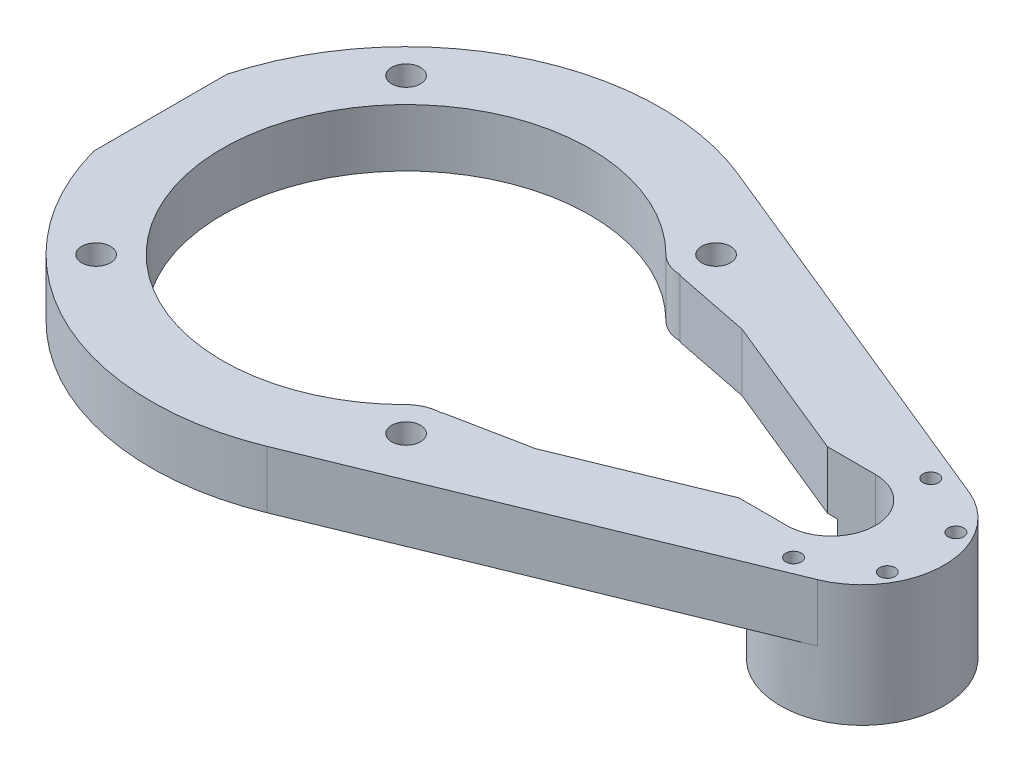
from build123d import *

# Parameters (mm, degrees)
SKETCH1_R           = 3.25
BOSS_EXTRUDE1_DEPTH = 13
BOSS_EXTRUDE2_START = -14.5
BOSS_EXTRUDE2_DEPTH = 14.5
CUT_EXTRUDE1_REACH  = 139.202
SKETCH3_R           = 1.75
SKETCH4_R           = 3.25
CUT_EXTRUDE2_DEPTH  = 5


with BuildPart() as part:
    # Sketch1 → Boss-Extrude1 (new body)
    with BuildSketch(Plane(origin=(0, 0, 0), x_dir=(1, 0, 0), z_dir=(0, 1, 0))):
        with BuildLine():
            ThreePointArc((21.76947877, 53.217002819), (-25.477840581, 51.544536415), (-55.5, 15.023634545))
            Line((-55.5, 15.023634545), (-55.5, -15.023634545))
            ThreePointArc((-55.5, -15.023634545), (-25.477840581, -51.544536415), (21.76947877, -53.217002819))
            Line((21.76947877, -53.217002819), (110.004400793, -17.122744217))
            ThreePointArc((110.004400793, -17.122744217), (121.5, 0), (110.004400793, 17.122744217))
            Line((110.004400793, 17.122744217), (21.76947877, 53.217002819))
        make_face()
        with Locations((-35, 35)):
            Circle(SKETCH1_R, mode=Mode.SUBTRACT)
        with BuildLine():
            ThreePointArc((29.343145829, 29.343145672), (31.938532593, 27.608963719), (35, 27))
            Line((35, 27), (35, 26.842197909))
            Line((35, 26.842197909), (52.547252782, 23.339790487))
            Line((52.547252782, 23.339790487), (85.157297123, 10))
            Line((85.157297123, 10), (96, 10))
            ThreePointArc((96, 10), (106, 0), (96, -10))
            Line((96, -10), (85.157297123, -10))
            Line((85.157297123, -10), (52.547252782, -23.339790487))
            Line((52.547252782, -23.339790487), (35, -26.842197909))
            Line((35, -26.842197909), (35, -27))
            ThreePointArc((35, -27), (31.938532454, -27.608963776), (29.343145617, -29.343145884))
            ThreePointArc((29.343145617, -29.343145884), (-41.497474683, 1.5e-07), (29.343145829, 29.343145672))
        make_face(mode=Mode.SUBTRACT)
        with Locations((35, 35)):
            Circle(SKETCH1_R, mode=Mode.SUBTRACT)
        with Locations((-35, -35)):
            Circle(SKETCH1_R, mode=Mode.SUBTRACT)
        with Locations((35, -35)):
            Circle(SKETCH1_R, mode=Mode.SUBTRACT)
    extrude(amount=BOSS_EXTRUDE1_DEPTH)

    # Sketch2 → Boss-Extrude2 (add)
    with BuildSketch(Plane(origin=(0, 0, 0), x_dir=(1, 0, 0), z_dir=(0, 1, 0)).offset(BOSS_EXTRUDE2_START)):
        with BuildLine():
            ThreePointArc((96, 10), (106, 0), (96, -10))
            Line((96, -10), (87.435617584, -10))
            ThreePointArc((87.435617584, -10), (108.210994401, -17.750930605), (121.5, 0))
            ThreePointArc((121.5, 0), (108.210994401, 17.750930605), (87.435617584, 10))
            Line((87.435617584, 10), (96, 10))
        make_face()
    extrude(amount=BOSS_EXTRUDE2_DEPTH)

    # Sketch3 → Cut-Extrude1 (cut, up to next)
    with BuildSketch(Plane.XZ.offset(14.5), mode=Mode.PRIVATE) as cut_extrude1_sk1:
        with Locations((103, 15.5)):
            Circle(SKETCH3_R)
    cut_extrude1_tool1 = extrude(cut_extrude1_sk1.sketch, amount=-CUT_EXTRUDE1_REACH, mode=Mode.PRIVATE) & part.part
    # Sketch3 → Cut-Extrude1 (cut, up to next)
    with BuildSketch(Plane.XZ.offset(14.5), mode=Mode.PRIVATE) as cut_extrude1_sk2:
        with Locations((116.423393759, 7.75)):
            Circle(SKETCH3_R)
    cut_extrude1_tool2 = extrude(cut_extrude1_sk2.sketch, amount=-CUT_EXTRUDE1_REACH, mode=Mode.PRIVATE) & part.part
    # Sketch3 → Cut-Extrude1 (cut, up to next)
    with BuildSketch(Plane.XZ.offset(14.5), mode=Mode.PRIVATE) as cut_extrude1_sk3:
        with Locations((116.423393759, -7.75)):
            Circle(SKETCH3_R)
    cut_extrude1_tool3 = extrude(cut_extrude1_sk3.sketch, amount=-CUT_EXTRUDE1_REACH, mode=Mode.PRIVATE) & part.part
    # Sketch3 → Cut-Extrude1 (cut, up to next)
    with BuildSketch(Plane.XZ.offset(14.5), mode=Mode.PRIVATE) as cut_extrude1_sk4:
        with Locations((103, -15.5)):
            Circle(SKETCH3_R)
    cut_extrude1_tool4 = extrude(cut_extrude1_sk4.sketch, amount=-CUT_EXTRUDE1_REACH, mode=Mode.PRIVATE) & part.part
    add(cut_extrude1_tool1.solids().sort_by_distance((103, -14.5, 15.5))[0], mode=Mode.SUBTRACT)
    add(cut_extrude1_tool2.solids().sort_by_distance((116.423394, -14.5, 7.75))[0], mode=Mode.SUBTRACT)
    add(cut_extrude1_tool3.solids().sort_by_distance((116.423394, -14.5, -7.75))[0], mode=Mode.SUBTRACT)
    add(cut_extrude1_tool4.solids().sort_by_distance((103, -14.5, -15.5))[0], mode=Mode.SUBTRACT)

    # Sketch4 → Cut-Extrude2 (cut)
    # profile 1 of 4: a face of its own
    with BuildSketch(Plane.XZ):
        Polygon((-33.430992924, 29.144385874), (-29.144385874, 33.430992924), (-30.71339295, 39.28660705), (-36.569007076, 40.855614126), (-40.855614126, 36.569007076), (-39.28660705, 30.71339295), align=None)
        with Locations((-35, 35)):
            Circle(SKETCH4_R, mode=Mode.SUBTRACT)
    # profile 2 of 4: a face of its own
    with BuildSketch(Plane.XZ):
        Polygon((33.430992924, 29.144385874), (39.28660705, 30.71339295), (40.855614126, 36.569007076), (36.569007076, 40.855614126), (30.71339295, 39.28660705), (29.144385874, 33.430992924), align=None)
        with Locations((35, 35)):
            Circle(SKETCH4_R, mode=Mode.SUBTRACT)
    # profile 3 of 4: a face of its own
    with BuildSketch(Plane.XZ):
        Polygon((-30.71339295, -39.28660705), (-29.144385874, -33.430992924), (-33.430992924, -29.144385874), (-39.28660705, -30.71339295), (-40.855614126, -36.569007076), (-36.569007076, -40.855614126), align=None)
        with Locations((-35, -35)):
            Circle(SKETCH4_R, mode=Mode.SUBTRACT)
    # profile 4 of 4: a face of its own
    with BuildSketch(Plane.XZ):
        Polygon((29.144385874, -33.430992924), (30.71339295, -39.28660705), (36.569007076, -40.855614126), (40.855614126, -36.569007076), (39.28660705, -30.71339295), (33.430992924, -29.144385874), align=None)
        with Locations((35, -35)):
            Circle(SKETCH4_R, mode=Mode.SUBTRACT)
    extrude(amount=-CUT_EXTRUDE2_DEPTH, mode=Mode.SUBTRACT)


solid = part.part
